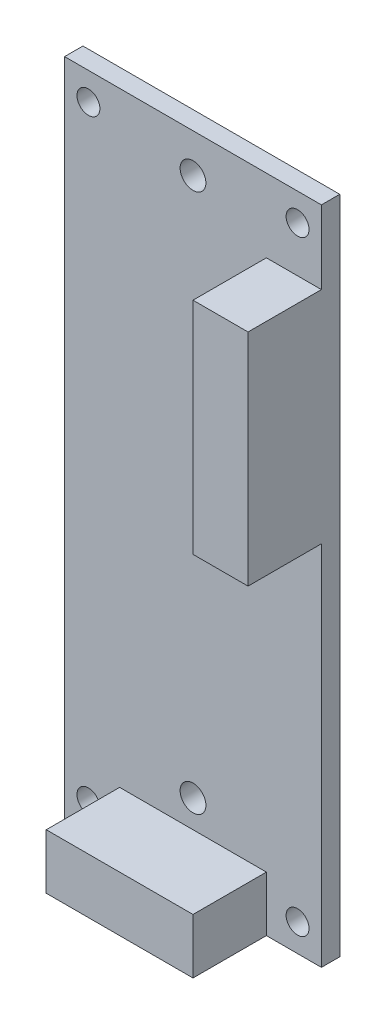
from build123d import *

# Parameters (mm, degrees)
SKETCH1_W                        = 35.56
SKETCH1_H                        = 91.44
EXTRUDE1_DEPTH                   = 2.54
F_28_0_1405_DIAMETER_HOLE1_D     = 3.5687
F_28_0_1405_DIAMETER_HOLE1_DEPTH = 15.24
F_28_0_1405_DIAMETER_HOLE1_TIP   = 1.072145646
EXTRUDE2_DEPTH                   = 10.16
SKETCH7_W                        = 7.62
SKETCH7_H                        = 30.48
EXTRUDE3_DEPTH                   = 10.16


with BuildPart() as part:
    # Sketch1 → Extrude1 (new body)
    with BuildSketch(Plane.XY):
        Rectangle(SKETCH1_W, SKETCH1_H)
    extrude(amount=EXTRUDE1_DEPTH)

    # Sketch3 → 1/8 (0.125) Diameter Hole1 (revolve, cut)
    with BuildSketch(Plane(origin=(14.478, 41.91, 2.54), x_dir=(0, -1, 0), z_dir=(1, 0, 0))):
        Polygon((0, 0), (0, 16.193866233), (1.5875, 15.24), (1.5875, 0), align=None)
    f_1_8_0_125_diameter_hole1 = revolve(axis=Axis((14.478, 41.91, 8.89), (0, 0, -1)), mode=Mode.SUBTRACT)

    # Mirror1: 1/8 (0.125) Diameter Hole1 across plane
    add(f_1_8_0_125_diameter_hole1.mirror(Plane(origin=(0, 0, 0), x_dir=(0, 0, 1), z_dir=(1, 0, 0))), mode=Mode.SUBTRACT)

    # Mirror2 copy 1 sketch → Mirror2 copy 1 (revolve, cut)
    with BuildSketch(Plane(origin=(-14.478, -41.91, 2.54), x_dir=(0, 1, 0), z_dir=(-1, 0, 0))):
        Polygon((0, 0), (0, 16.193866233), (1.5875, 15.24), (1.5875, 0), align=None)
    revolve(axis=Axis((-14.478, -41.91, 8.89), (0, 0, -1)), mode=Mode.SUBTRACT)

    # Mirror2 copy 2 sketch → Mirror2 copy 2 (revolve, cut)
    with BuildSketch(Plane(origin=(14.478, -41.91, 2.54), x_dir=(0, 1, 0), z_dir=(1, 0, 0))):
        Polygon((0, 0), (0, -16.193866233), (1.5875, -15.24), (1.5875, 0), align=None)
    revolve(axis=Axis((14.478, -41.91, 8.89), (0, 0, 1)), mode=Mode.SUBTRACT)

    # #28 (0.1405) Diameter Hole1
    with Locations(Plane(origin=(0, -34.29, 2.54), x_dir=(1, 0, 0), z_dir=(0, 0, 1))):
        with Locations((0, 0), (0, 74.639874629)):
            Hole(F_28_0_1405_DIAMETER_HOLE1_D / 2, depth=F_28_0_1405_DIAMETER_HOLE1_DEPTH)
            with Locations((0, 0, -(F_28_0_1405_DIAMETER_HOLE1_DEPTH + F_28_0_1405_DIAMETER_HOLE1_TIP / 2))):  # 118° drill point
                Cone(0, F_28_0_1405_DIAMETER_HOLE1_D / 2, F_28_0_1405_DIAMETER_HOLE1_TIP, mode=Mode.SUBTRACT)

    # Sketch6 → Extrude2 (add)
    with BuildSketch(Plane.XY.offset(2.54)):
        Polygon((0, -45.72), (10.16, -45.72), (10.16, -38.1), (-10.16, -38.1), (-10.16, -45.72), align=None)
    extrude(amount=EXTRUDE2_DEPTH)

    # Sketch7 → Extrude3 (add)
    with BuildSketch(Plane.XY.offset(2.54)):
        with Locations((13.97, 20.32)):
            Rectangle(SKETCH7_W, SKETCH7_H)
    extrude(amount=EXTRUDE3_DEPTH)


solid = part.part
